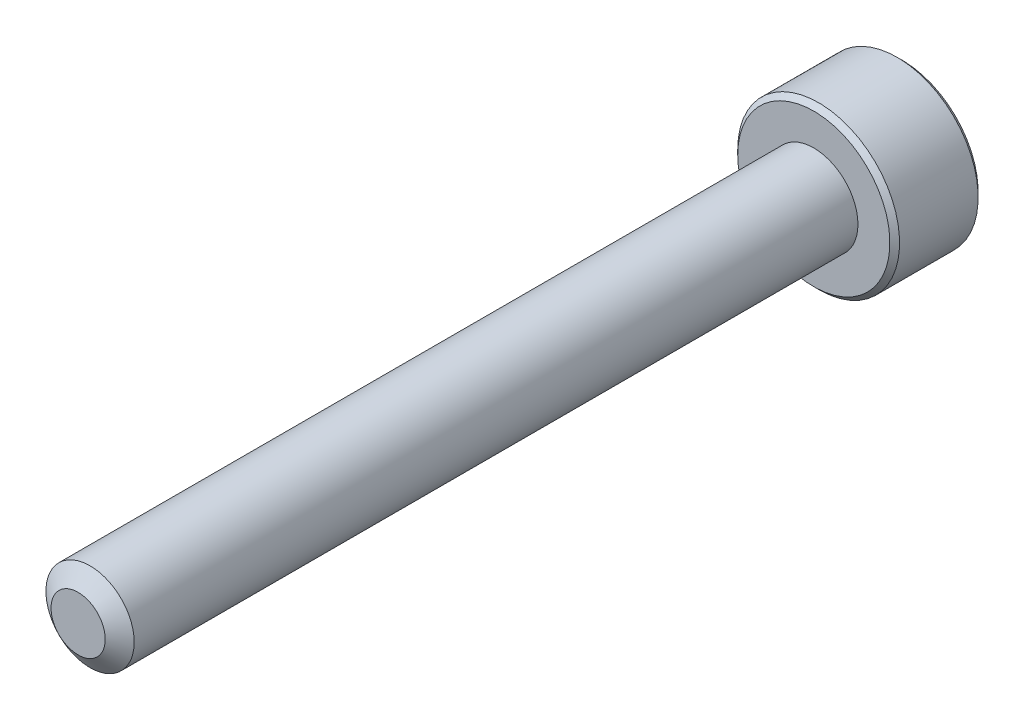
from build123d import *

# Parameters (mm, degrees)
SKETCH1_R          = 1.5
EXTRUDE1_DEPTH     = 25
SKETCH6_R          = 2.75
EXTRUDE2_DEPTH     = 3
CUT_EXTRUDE1_DEPTH = 1.875
CHAMFER1_SIZE      = 0.165


with BuildPart() as part:
    # Sketch1 → Extrude1 (new body)
    with BuildSketch(Plane.XY):
        Circle(SKETCH1_R)
    extrude(amount=-EXTRUDE1_DEPTH)

    # Sketch4 → Cut-Revolve1 (revolve, cut)
    with BuildSketch(Plane(origin=(0, 0, 0), x_dir=(0, 0, -1), z_dir=(1, 0, 0))):
        Polygon((0.405251783, 1.5), (0, 0.921240474), (0, 1.5), align=None)
    revolve(axis=Axis((0, 0, 0), (0, 0, -1)), mode=Mode.SUBTRACT)

    # Sketch6 → Extrude2 (add)
    with BuildSketch(Plane(origin=(0, 0, -25), x_dir=(-1, 0, 0), z_dir=(0, 0, -1))):
        Circle(SKETCH6_R)
    extrude(amount=EXTRUDE2_DEPTH)

    # Sketch7 → Cut-Extrude1 (cut)
    with BuildSketch(Plane(origin=(0, 0, -28), x_dir=(-1, 0, 0), z_dir=(0, 0, -1))):
        Polygon((0, 1.443375673), (-1.25, 0.721687836), (-1.25, -0.721687836), (0, -1.443375673), (1.25, -0.721687836), (1.25, 0.721687836), align=None)
    extrude(amount=-CUT_EXTRUDE1_DEPTH, mode=Mode.SUBTRACT)

    # Cut-Extrude2 cone 1 section (through the dimple's axis) → Cut-Extrude2 (revolve, cut)
    with BuildSketch(Plane(origin=(0, 0, -28), x_dir=(0, 1, 0), z_dir=(1, 0, 0))):
        Polygon((0, 0), (1.443375673, 0), (0, 1.443375673), align=None)
    revolve(axis=Axis((0, 0, -28), (0, 0, 1)), mode=Mode.SUBTRACT)

    # Chamfer1
    chamfer1_edges = [part.edges().sort_by_distance(p)[0] for p in [
        (2.75, 0, -28),
        (2.75, 0, -25),
    ]]
    chamfer(chamfer1_edges, length=CHAMFER1_SIZE)


solid = part.part
